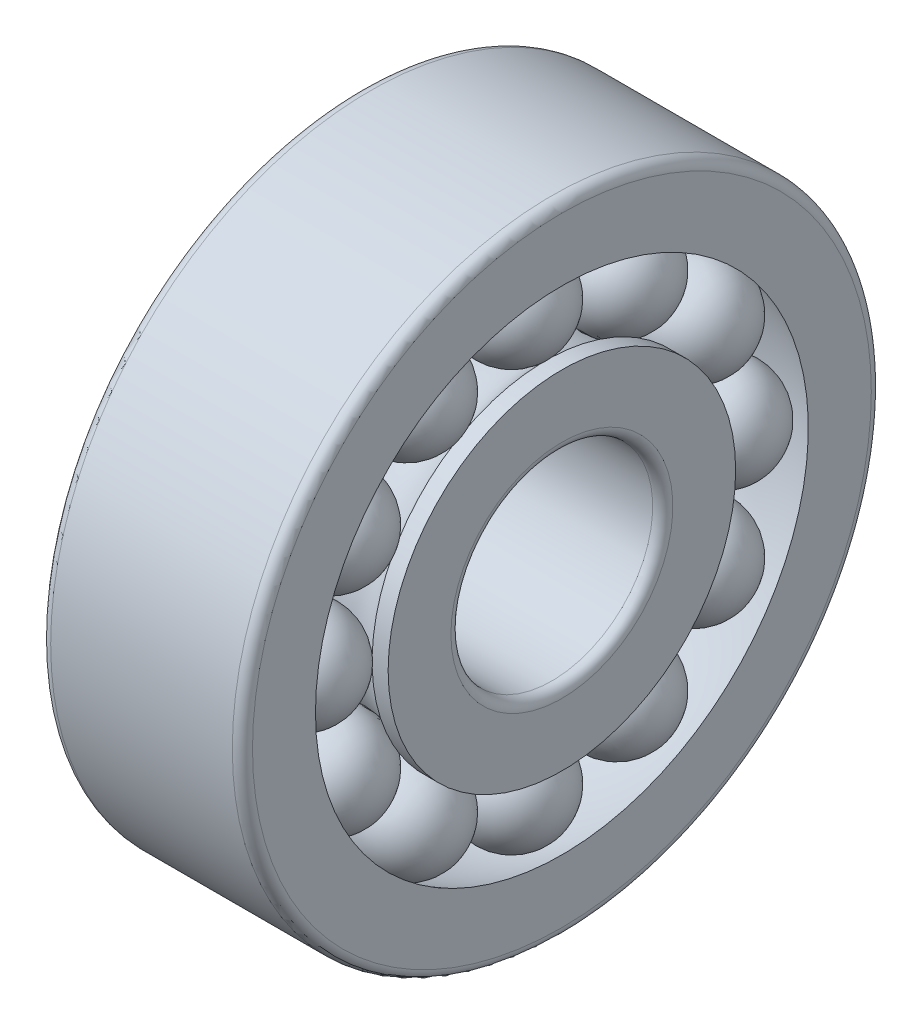
from build123d import *

# Parameters (mm, degrees)
CIRCULAR_PATTERN1_COUNT = 12
FILLET1_R               = 0.3


with BuildPart() as part:
    # Sketch1 → Revovle1 (revolve)
    with BuildSketch(Plane.XY):
        with BuildLine():
            Line((-3, 3), (3, 3))
            Line((3, 3), (3, 5.166666667))
            Line((3, 5.166666667), (2.522980395, 5.166666667))
            ThreePointArc((2.522980395, 5.166666667), (1.5, 4.76), (0.477019605, 5.166666667))
            Line((0.477019605, 5.166666667), (-0.477019605, 5.166666667))
            ThreePointArc((-0.477019605, 5.166666667), (-1.5, 4.76), (-2.522980395, 5.166666667))
            Line((-2.522980395, 5.166666667), (-3, 5.166666667))
            Line((-3, 5.166666667), (-3, 3))
        make_face()
    revolve(axis=Axis((0, 0, 0), (1, 0, 0)))

    # Sketch2 → Revolve2 (revolve)
    with BuildSketch(Plane.XY):
        with BuildLine():
            Line((-2.9995, 6.25), (-0.0005, 6.25))
            ThreePointArc((-0.0005, 6.25), (-1.5, 4.7505), (-2.9995, 6.25))
        make_face()
    revolve2 = revolve(axis=Axis((-4.033551893, 6.25, 0), (1, 0, 0)))

    # Mirror1: Revolve2 across plane
    add(revolve2.mirror(Plane(origin=(0, 0, 0), x_dir=(0, 0, 1), z_dir=(1, 0, 0))))

    # Sketch3 → Revolve3 (revolve)
    with BuildSketch(Plane.XY):
        with BuildLine():
            Line((-3, 7.327106564), (-3, 9.5))
            Line((-3, 9.5), (3, 9.5))
            Line((3, 9.5), (3, 7.327106564))
            ThreePointArc((3, 7.327106564), (0, 7.917480066), (-3, 7.327106564))
        make_face()
    revolve(axis=Axis((0, 0, 0), (1, 0, 0)))

    # Circular-Pattern1: Revolve2 ×12 about axis
    circular_pattern1_axis = Axis((0, 0, 0), (1, 0, 0))
    for i in range(1, CIRCULAR_PATTERN1_COUNT):
        add(revolve2.rotate(circular_pattern1_axis, i * 360 / CIRCULAR_PATTERN1_COUNT))

    # Circular-Pattern1 copy 1 sketch → Circular-Pattern1 copy 1 (revolve)
    with BuildSketch(Plane(origin=(0, 0, 0), x_dir=(-1, 0, 0), z_dir=(0, -0.49999999999999994, 0.8660254037844387))):
        with BuildLine():
            Line((-2.9995, -6.25), (-0.0005, -6.25))
            ThreePointArc((-0.0005, -6.25), (-1.5, -4.7505), (-2.9995, -6.25))
        make_face()
    revolve(axis=Axis((4.033551893, 5.412658774, 3.125), (1, 0, 0)))

    # Circular-Pattern1 copy 2 sketch → Circular-Pattern1 copy 2 (revolve)
    with BuildSketch(Plane(origin=(0, 0, 0), x_dir=(-1, 0, 0), z_dir=(0, -0.8660254037844386, 0.5000000000000001))):
        with BuildLine():
            Line((-2.9995, -6.25), (-0.0005, -6.25))
            ThreePointArc((-0.0005, -6.25), (-1.5, -4.7505), (-2.9995, -6.25))
        make_face()
    revolve(axis=Axis((4.033551893, 3.125, 5.412658774), (1, 0, 0)))

    # Circular-Pattern1 copy 3 sketch → Circular-Pattern1 copy 3 (revolve)
    with BuildSketch(Plane(origin=(0, 0, 0), x_dir=(-1, 0, 0), z_dir=(0, -1, 0))):
        with BuildLine():
            Line((-2.9995, -6.25), (-0.0005, -6.25))
            ThreePointArc((-0.0005, -6.25), (-1.5, -4.7505), (-2.9995, -6.25))
        make_face()
    revolve(axis=Axis((4.033551893, 0, 6.25), (1, 0, 0)))

    # Circular-Pattern1 copy 4 sketch → Circular-Pattern1 copy 4 (revolve)
    with BuildSketch(Plane(origin=(0, 0, 0), x_dir=(-1, 0, 0), z_dir=(0, -0.8660254037844387, -0.4999999999999998))):
        with BuildLine():
            Line((-2.9995, -6.25), (-0.0005, -6.25))
            ThreePointArc((-0.0005, -6.25), (-1.5, -4.7505), (-2.9995, -6.25))
        make_face()
    revolve(axis=Axis((4.033551893, -3.125, 5.412658774), (1, 0, 0)))

    # Circular-Pattern1 copy 5 sketch → Circular-Pattern1 copy 5 (revolve)
    with BuildSketch(Plane(origin=(0, 0, 0), x_dir=(-1, 0, 0), z_dir=(0, -0.49999999999999994, -0.8660254037844387))):
        with BuildLine():
            Line((-2.9995, -6.25), (-0.0005, -6.25))
            ThreePointArc((-0.0005, -6.25), (-1.5, -4.7505), (-2.9995, -6.25))
        make_face()
    revolve(axis=Axis((4.033551893, -5.412658774, 3.125), (1, 0, 0)))

    # Circular-Pattern1 copy 6 sketch → Circular-Pattern1 copy 6 (revolve)
    with BuildSketch(Plane(origin=(0, 0, 0), x_dir=(-1, 0, 0), z_dir=(0, 0, -1))):
        with BuildLine():
            Line((-2.9995, -6.25), (-0.0005, -6.25))
            ThreePointArc((-0.0005, -6.25), (-1.5, -4.7505), (-2.9995, -6.25))
        make_face()
    revolve(axis=Axis((4.033551893, -6.25, 0), (1, 0, 0)))

    # Circular-Pattern1 copy 7 sketch → Circular-Pattern1 copy 7 (revolve)
    with BuildSketch(Plane(origin=(0, 0, 0), x_dir=(-1, 0, 0), z_dir=(0, 0.5000000000000001, -0.8660254037844386))):
        with BuildLine():
            Line((-2.9995, -6.25), (-0.0005, -6.25))
            ThreePointArc((-0.0005, -6.25), (-1.5, -4.7505), (-2.9995, -6.25))
        make_face()
    revolve(axis=Axis((4.033551893, -5.412658774, -3.125), (1, 0, 0)))

    # Circular-Pattern1 copy 8 sketch → Circular-Pattern1 copy 8 (revolve)
    with BuildSketch(Plane(origin=(0, 0, 0), x_dir=(-1, 0, 0), z_dir=(0, 0.8660254037844384, -0.5000000000000004))):
        with BuildLine():
            Line((-2.9995, -6.25), (-0.0005, -6.25))
            ThreePointArc((-0.0005, -6.25), (-1.5, -4.7505), (-2.9995, -6.25))
        make_face()
    revolve(axis=Axis((4.033551893, -3.125, -5.412658774), (1, 0, 0)))

    # Circular-Pattern1 copy 9 sketch → Circular-Pattern1 copy 9 (revolve)
    with BuildSketch(Plane(origin=(0, 0, 0), x_dir=(-1, 0, 0), z_dir=(0, 1, 0))):
        with BuildLine():
            Line((-2.9995, -6.25), (-0.0005, -6.25))
            ThreePointArc((-0.0005, -6.25), (-1.5, -4.7505), (-2.9995, -6.25))
        make_face()
    revolve(axis=Axis((4.033551893, 0, -6.25), (1, 0, 0)))

    # Circular-Pattern1 copy 10 sketch → Circular-Pattern1 copy 10 (revolve)
    with BuildSketch(Plane(origin=(0, 0, 0), x_dir=(-1, 0, 0), z_dir=(0, 0.8660254037844386, 0.5000000000000001))):
        with BuildLine():
            Line((-2.9995, -6.25), (-0.0005, -6.25))
            ThreePointArc((-0.0005, -6.25), (-1.5, -4.7505), (-2.9995, -6.25))
        make_face()
    revolve(axis=Axis((4.033551893, 3.125, -5.412658774), (1, 0, 0)))

    # Circular-Pattern1 copy 11 sketch → Circular-Pattern1 copy 11 (revolve)
    with BuildSketch(Plane(origin=(0, 0, 0), x_dir=(-1, 0, 0), z_dir=(0, 0.5000000000000004, 0.8660254037844384))):
        with BuildLine():
            Line((-2.9995, -6.25), (-0.0005, -6.25))
            ThreePointArc((-0.0005, -6.25), (-1.5, -4.7505), (-2.9995, -6.25))
        make_face()
    revolve(axis=Axis((4.033551893, 5.412658774, -3.125), (1, 0, 0)))

    # Fillet1
    fillet1_edges = [part.edges().sort_by_distance(p)[0] for p in [
        (-3, -3, 0),
        (-3, -9.5, 0),
        (3, -3, 0),
        (3, -9.5, 0),
    ]]
    fillet(fillet1_edges, radius=FILLET1_R)


solid = part.part
